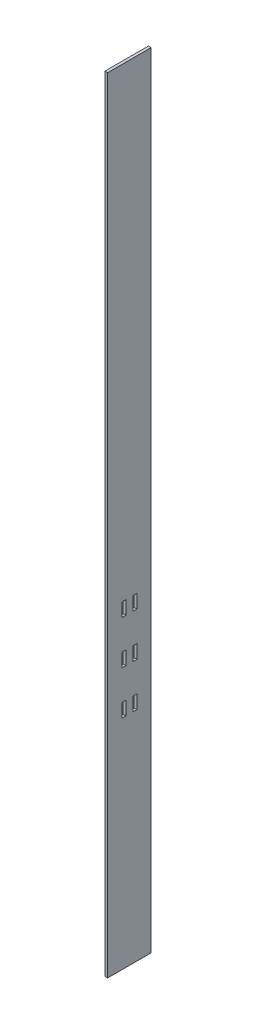
from build123d import *

# Parameters (mm, degrees)
SKETCH1_W                 = 50.8
SKETCH1_H                 = 914.4
BOSS_EXTRUDE1_DEPTH       = 3.175
SKETCH2_W                 = 4.7625
SKETCH2_H                 = 15.875
CUT_EXTRUDE1_DEPTH        = 458.916019184
LPATTERN1_COPY_1_SKETCH_W = 4.7625
LPATTERN1_COPY_1_SKETCH_H = 15.875
LPATTERN1_COPY_1_DEPTH    = 458.916019184
LPATTERN1_COPY_2_SKETCH_W = 4.7625
LPATTERN1_COPY_2_SKETCH_H = 15.875
LPATTERN1_COPY_2_DEPTH    = 458.916019184
LPATTERN1_COPY_3_SKETCH_W = 4.7625
LPATTERN1_COPY_3_SKETCH_H = 15.875
LPATTERN1_COPY_3_DEPTH    = 458.916019184
LPATTERN1_COPY_4_SKETCH_W = 4.7625
LPATTERN1_COPY_4_SKETCH_H = 15.875
LPATTERN1_COPY_4_DEPTH    = 458.916019184
LPATTERN1_COPY_5_SKETCH_W = 4.7625
LPATTERN1_COPY_5_SKETCH_H = 15.875
LPATTERN1_COPY_5_DEPTH    = 458.916019184
LPATTERN1_COPY_6_SKETCH_W = 4.7625
LPATTERN1_COPY_6_SKETCH_H = 15.875
LPATTERN1_COPY_6_DEPTH    = 458.916019184


with BuildPart() as part:
    # Sketch1 → Boss-Extrude1 (new body)
    with BuildSketch(Plane(origin=(0, 0, 0), x_dir=(0, 0, -1), z_dir=(1, 0, 0))):
        Rectangle(SKETCH1_W, SKETCH1_H)
    extrude(amount=BOSS_EXTRUDE1_DEPTH)

    # Sketch2 → Cut-Extrude1 (cut, through all)
    with BuildSketch(Plane(origin=(3.175, 0, 0), x_dir=(0, 0, -1), z_dir=(1, 0, 0))):
        with Locations((6.38125, -144.4625)):
            Rectangle(SKETCH2_W, SKETCH2_H)
    cut_extrude1 = extrude(amount=-CUT_EXTRUDE1_DEPTH, mode=Mode.SUBTRACT)

    # Mirror1: Cut-Extrude1 across plane
    add(cut_extrude1.mirror(Plane.XY), mode=Mode.SUBTRACT)

    # LPattern1 copy 1 sketch → LPattern1 copy 1 (cut, through all)
    with BuildSketch(Plane(origin=(3.175, -50.8, 0), x_dir=(0, 0, 1), z_dir=(1, 0, 0))):
        with Locations((6.38125, 144.4625)):
            Rectangle(LPATTERN1_COPY_1_SKETCH_W, LPATTERN1_COPY_1_SKETCH_H)
    extrude(amount=-LPATTERN1_COPY_1_DEPTH, mode=Mode.SUBTRACT)

    # LPattern1 copy 2 sketch → LPattern1 copy 2 (cut, through all)
    with BuildSketch(Plane(origin=(3.175, 50.8, 0), x_dir=(0, 0, 1), z_dir=(1, 0, 0))):
        with Locations((6.38125, 144.4625)):
            Rectangle(LPATTERN1_COPY_2_SKETCH_W, LPATTERN1_COPY_2_SKETCH_H)
    extrude(amount=-LPATTERN1_COPY_2_DEPTH, mode=Mode.SUBTRACT)

    # LPattern1 copy 3 sketch → LPattern1 copy 3 (cut, through all)
    with BuildSketch(Plane(origin=(3.175, 0, 0), x_dir=(0, 0, 1), z_dir=(1, 0, 0))):
        with Locations((6.38125, 144.4625)):
            Rectangle(LPATTERN1_COPY_3_SKETCH_W, LPATTERN1_COPY_3_SKETCH_H)
    extrude(amount=-LPATTERN1_COPY_3_DEPTH, mode=Mode.SUBTRACT)

    # LPattern1 copy 4 sketch → LPattern1 copy 4 (cut, through all)
    with BuildSketch(Plane(origin=(3.175, -50.8, 0), x_dir=(0, 0, -1), z_dir=(1, 0, 0))):
        with Locations((6.38125, -144.4625)):
            Rectangle(LPATTERN1_COPY_4_SKETCH_W, LPATTERN1_COPY_4_SKETCH_H)
    extrude(amount=-LPATTERN1_COPY_4_DEPTH, mode=Mode.SUBTRACT)

    # LPattern1 copy 5 sketch → LPattern1 copy 5 (cut, through all)
    with BuildSketch(Plane(origin=(3.175, 50.8, 0), x_dir=(0, 0, -1), z_dir=(1, 0, 0))):
        with Locations((6.38125, -144.4625)):
            Rectangle(LPATTERN1_COPY_5_SKETCH_W, LPATTERN1_COPY_5_SKETCH_H)
    extrude(amount=-LPATTERN1_COPY_5_DEPTH, mode=Mode.SUBTRACT)

    # LPattern1 copy 6 sketch → LPattern1 copy 6 (cut, through all)
    with BuildSketch(Plane(origin=(3.175, 0, 0), x_dir=(0, 0, -1), z_dir=(1, 0, 0))):
        with Locations((6.38125, -144.4625)):
            Rectangle(LPATTERN1_COPY_6_SKETCH_W, LPATTERN1_COPY_6_SKETCH_H)
    extrude(amount=-LPATTERN1_COPY_6_DEPTH, mode=Mode.SUBTRACT)


solid = part.part
